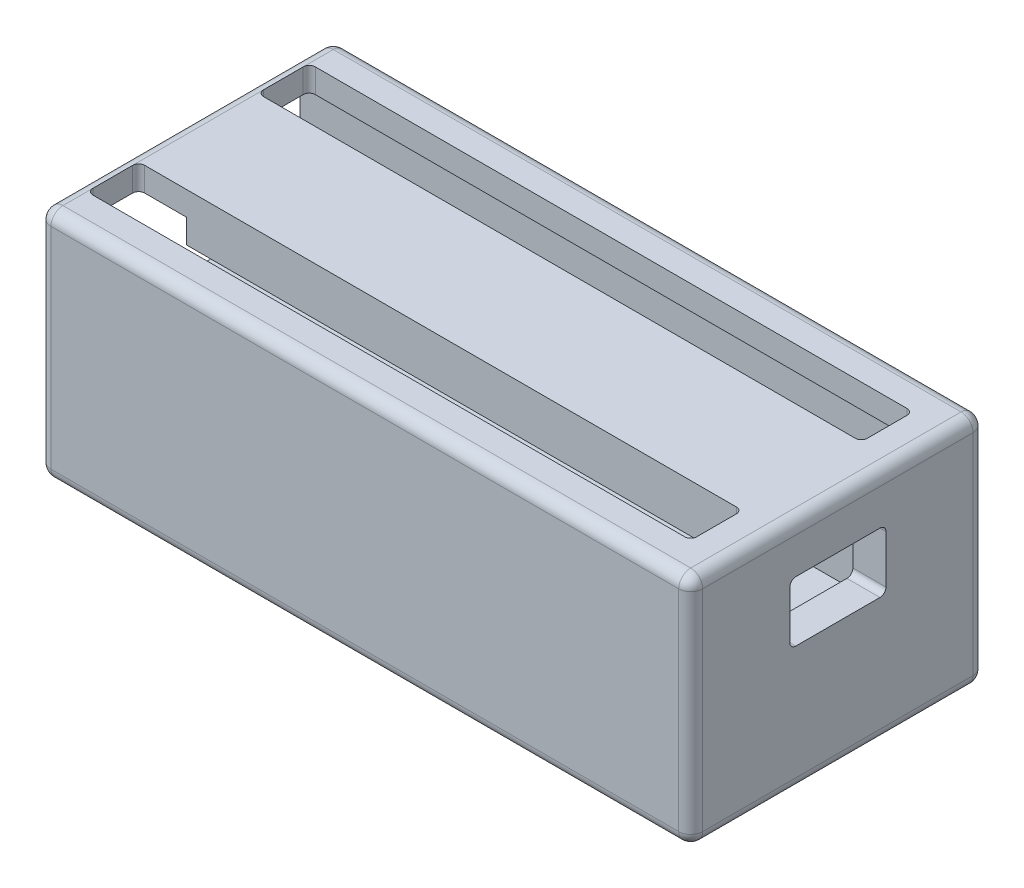
from build123d import *

# Parameters (mm, degrees)
SKETCH2_W           = 54.25
SKETCH2_H           = 24.5
BOSS_EXTRUDE1_DEPTH = 2
BOSS_EXTRUDE2_DEPTH = 15.5
SKETCH5_W           = 54.25
SKETCH5_H           = 24.5
BOSS_EXTRUDE3_DEPTH = 2
SKETCH6_W           = 11.5
SKETCH6_H           = 6.5
SKETCH6_H_2         = 2
BOSS_EXTRUDE4_DEPTH = 51.5
SKETCH8_W           = 50.25
SKETCH8_H           = 4.3
CUT_EXTRUDE1_DEPTH  = 37.350077373
SKETCH9_W           = 11.5
SKETCH9_H           = 2
CUT_EXTRUDE2_DEPTH  = 5
SKETCH10_W          = 8
SKETCH10_H          = 5
CUT_EXTRUDE3_DEPTH  = 5
FILLET1_R           = 0.5
FILLET2_R           = 1


with BuildPart() as part:
    # Sketch2 → Boss-Extrude1 (new body)
    with BuildSketch(Plane(origin=(0, 0, 0), x_dir=(1, 0, 0), z_dir=(0, 1, 0))):
        with Locations((1, 0)):
            Rectangle(SKETCH2_W, SKETCH2_H)
    extrude(amount=BOSS_EXTRUDE1_DEPTH)

    # Sketch3 → Boss-Extrude2 (add)
    with BuildSketch(Plane(origin=(0, 2, 0), x_dir=(1, 0, 0), z_dir=(0, 1, 0))):
        Polygon((-26.125, 12.25), (28.125, 12.25), (28.125, -12.25), (-26.125, -12.25), (-26.125, -9.5), (25.375, -9.5), (25.375, 9.5), (-26.125, 9.5), align=None)
    extrude(amount=BOSS_EXTRUDE2_DEPTH)

    # Sketch5 → Boss-Extrude3 (add)
    with BuildSketch(Plane(origin=(0, 17.5, 0), x_dir=(1, 0, 0), z_dir=(0, 1, 0))):
        with Locations((1, 0)):
            Rectangle(SKETCH5_W, SKETCH5_H)
    extrude(amount=BOSS_EXTRUDE3_DEPTH)

    # Sketch6 → Boss-Extrude4 (add)
    with BuildSketch(Plane.ZY.offset(-25.375)):
        with Locations((0, 5.25)):
            Rectangle(SKETCH6_W, SKETCH6_H)
        with Locations((0, 16.5)):
            Rectangle(SKETCH6_W, SKETCH6_H_2)
    extrude(amount=BOSS_EXTRUDE4_DEPTH)

    # Sketch8 → Cut-Extrude1 (cut, through all)
    with BuildSketch(Plane(origin=(0, 19.5, 0), x_dir=(1, 0, 0), z_dir=(0, 1, 0))):
        with Locations((0, 7.1)):
            Rectangle(SKETCH8_W, SKETCH8_H)
        with Locations((0, -7.1)):
            Rectangle(SKETCH8_W, SKETCH8_H)
    extrude(amount=-CUT_EXTRUDE1_DEPTH, mode=Mode.SUBTRACT)

    # Sketch9 → Cut-Extrude2 (cut)
    with BuildSketch(Plane.ZY.offset(26.125)):
        with Locations((0, 16.5)):
            Rectangle(SKETCH9_W, SKETCH9_H)
    extrude(amount=-CUT_EXTRUDE2_DEPTH, mode=Mode.SUBTRACT)

    # Sketch10 → Cut-Extrude3 (cut)
    with BuildSketch(Plane.ZY.offset(-25.375)):
        with Locations((0, 13)):
            Rectangle(SKETCH10_W, SKETCH10_H)
    extrude(amount=-CUT_EXTRUDE3_DEPTH, mode=Mode.SUBTRACT)

    # Fillet1
    fillet1_edges = [part.edges().sort_by_distance(p)[0] for p in [
        (-25.125, 18.5, -9.25),
        (25.125, 18.5, -9.25),
        (25.125, 4.25, -4.95),
        (25.125, 17.5, -4.95),
        (-25.125, 4.25, -4.95),
        (-25.125, 1, -9.25),
        (25.125, 1, -9.25),
        (25.125, 18.5, 9.25),
        (-25.125, 4.25, 4.95),
        (25.125, 17.5, 4.95),
        (-25.125, 18.5, 9.25),
        (25.125, 4.25, 4.95),
        (25.125, 1, 9.25),
        (-25.125, 1, 9.25),
        (-25.125, 18.5, -4.95),
        (-25.125, 18.5, 4.95),
        (26.75, 10.5, -4),
        (26.75, 15.5, -4),
        (26.75, 15.5, 4),
        (26.75, 10.5, 4),
    ]]
    fillet(fillet1_edges, radius=FILLET1_R)

    # Fillet2
    fillet2_edges = [part.edges().sort_by_distance(p)[0] for p in [
        (-26.125, 19.5, 0),
        (1, 19.5, 12.25),
        (28.125, 19.5, 0),
        (1, 19.5, -12.25),
        (28.125, 0, 0),
        (1, 0, 12.25),
        (-26.125, 0, 0),
        (1, 0, -12.25),
        (28.125, 9.75, -12.25),
        (28.125, 9.75, 12.25),
        (-26.125, 9.75, 12.25),
        (-26.125, 9.75, -12.25),
    ]]
    fillet(fillet2_edges, radius=FILLET2_R - 0.0001)  # a hair under: the kernel refuses the full size


solid = part.part
